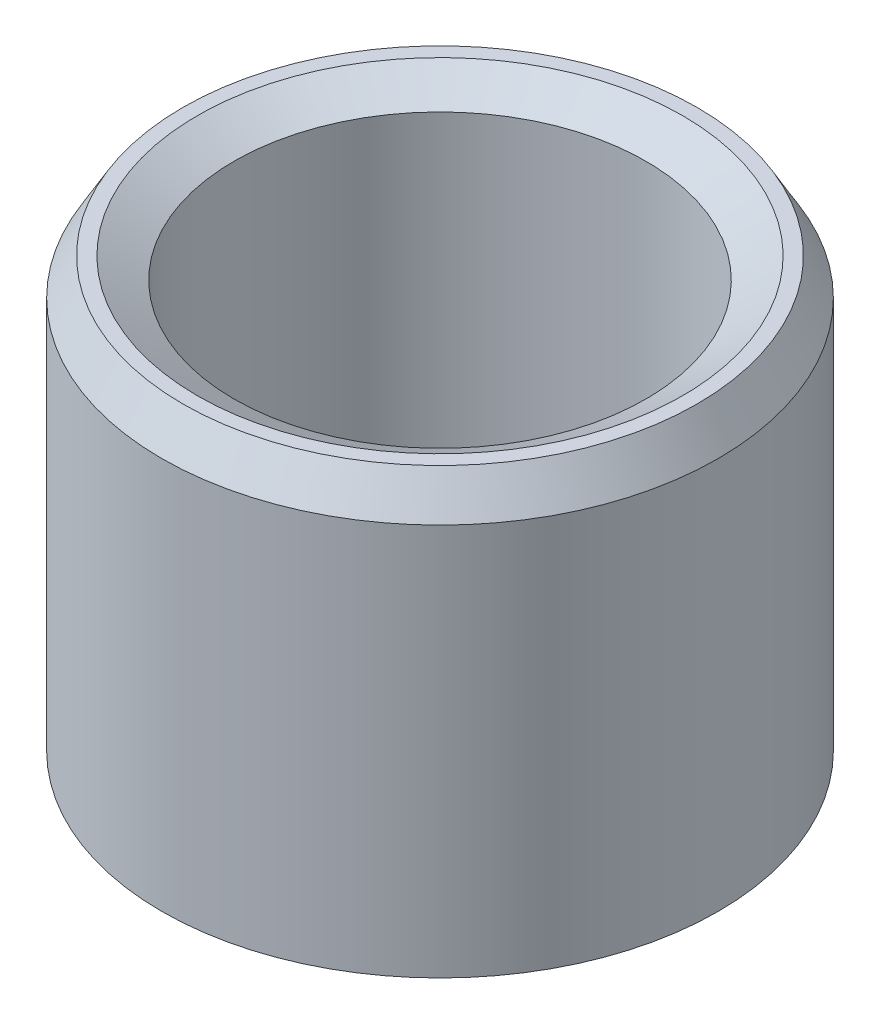
from build123d import *
from OCP.BRepFilletAPI import BRepFilletAPI_MakeChamfer

# Parameters (mm, degrees)
SKETCH1_R           = 10
BOSS_EXTRUDE1_DEPTH = 16.178033161
SKETCH2_R           = 7.405131486
CUT_EXTRUDE1_DEPTH  = 22.48787465
CHAMFER1_SIZE       = 1.317570315
CHAMFER1_SIZE2      = 0.760699576


with BuildPart() as part:
    # Sketch1 → Boss-Extrude1 (new body)
    with BuildSketch(Plane(origin=(0, 0, 0), x_dir=(1, 0, 0), z_dir=(0, 1, 0))):
        Circle(SKETCH1_R)
    extrude(amount=BOSS_EXTRUDE1_DEPTH)

    # Sketch2 → Cut-Extrude1 (cut, through all)
    with BuildSketch(Plane(origin=(0, 0, 0), x_dir=(1, 0, 0), z_dir=(0, 1, 0))):
        Circle(SKETCH2_R)
    extrude(amount=CUT_EXTRUDE1_DEPTH, mode=Mode.SUBTRACT)

    # Chamfer1: one chamfer whose edges measure the first distance from different faces: ONE call of the kernel's chamfer builder (chamfer() names one face for all edges)
    chamfer1_edges_1 = [part.edges().sort_by_distance(p)[0] for p in [
        (-7.405131486, 16.178033161, 0),
    ]]
    chamfer1_side_1 = [part.faces().sort_by_distance(p)[0] for p in [
        (-9.717157288, 16.178033161, 0),
    ]]
    chamfer1_edges_2 = [part.edges().sort_by_distance(p)[0] for p in [
        (-7.405131486, 0, 0),
    ]]
    chamfer1_side_2 = [part.faces().sort_by_distance(p)[0] for p in [
        (-7.405131486, 8.08901658, 0),
    ]]
    chamfer1_edges_3 = [part.edges().sort_by_distance(p)[0] for p in [
        (-10, 0, 0),
    ]]
    chamfer1_side_3 = [part.faces().sort_by_distance(p)[0] for p in [
        (-9.717157288, 0, 0),
    ]]
    chamfer1_edges_4 = [part.edges().sort_by_distance(p)[0] for p in [
        (-10, 16.178033161, 0),
    ]]
    chamfer1_side_4 = [part.faces().sort_by_distance(p)[0] for p in [
        (-10, 8.08901658, 0),
    ]]
    chamfer1 = BRepFilletAPI_MakeChamfer(part.part.solid().wrapped)
    for e in chamfer1_edges_1:
        chamfer1.Add(CHAMFER1_SIZE, CHAMFER1_SIZE2, e.wrapped, chamfer1_side_1[0].wrapped)  # the first distance lies on this face
    for e in chamfer1_edges_2:
        chamfer1.Add(CHAMFER1_SIZE, CHAMFER1_SIZE2, e.wrapped, chamfer1_side_2[0].wrapped)  # the first distance lies on this face
    for e in chamfer1_edges_3:
        chamfer1.Add(CHAMFER1_SIZE, CHAMFER1_SIZE2, e.wrapped, chamfer1_side_3[0].wrapped)  # the first distance lies on this face
    for e in chamfer1_edges_4:
        chamfer1.Add(CHAMFER1_SIZE, CHAMFER1_SIZE2, e.wrapped, chamfer1_side_4[0].wrapped)  # the first distance lies on this face
    add(Compound.cast(chamfer1.Shape()), mode=Mode.REPLACE)


solid = part.part
